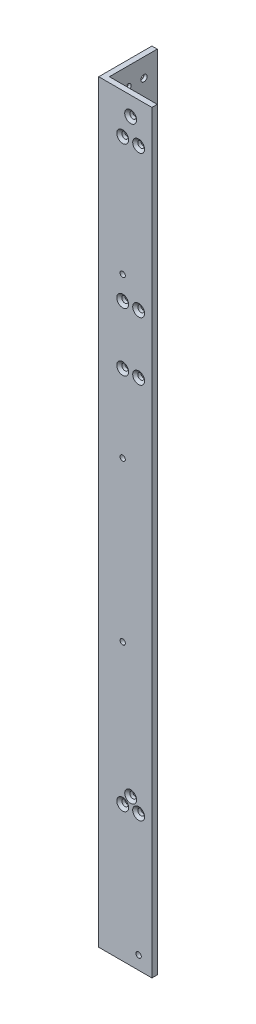
from build123d import *

# Parameters (mm, degrees)
BOSS_EXTRUDE1_DEPTH                               = 450
RIGHTSIDEHOLES_SKETCH3_R                          = 1.5875
RIGHTSIDEHOLES_CUT_EXTRUDE1_DEPTH                 = 3.175
FRONTSIDEHOLES_SKETCH4_R                          = 1.5875
FRONTSIDEHOLES_SKETCH4_R_2                        = 2
FRONTSIDEHOLES_CUT_EXTRUDE2_DEPTH                 = 3.175
CSK_FOR_6_FLAT_HEAD_MACHINE_SCREW_100_D           = 3.7973
CSK_FOR_6_FLAT_HEAD_MACHINE_SCREW_100_CSINK_D     = 7.0866
CSK_FOR_6_FLAT_HEAD_MACHINE_SCREW_100_CSINK_ANGLE = 100
CSK_FOR_6_FLAT_HEAD_MACHINE_SCREW_2_D             = 3.7973
CSK_FOR_6_FLAT_HEAD_MACHINE_SCREW_2_CSINK_D       = 7.0866
CSK_FOR_6_FLAT_HEAD_MACHINE_SCREW_2_CSINK_ANGLE   = 100


with BuildPart() as part:
    # Sketch2 → Boss-Extrude1 (new body)
    with BuildSketch(Plane(origin=(0, 0, 0), x_dir=(1, 0, 0), z_dir=(0, 1, 0))):
        Polygon((0, 31.75), (3.175, 31.75), (3.175, 3.175), (31.75, 3.175), (31.75, 0), (0, 0), align=None)
    extrude(amount=BOSS_EXTRUDE1_DEPTH)

    # RightSideHoles-Sketch3 → RightSideHoles-Cut-Extrude1 (cut)
    with BuildSketch(Plane.XY):
        with Locations((14.2875, 81.1125)):
            Circle(RIGHTSIDEHOLES_SKETCH3_R)
        with Locations((23.8125, 81.1125)):
            Circle(RIGHTSIDEHOLES_SKETCH3_R)
        with Locations((19.05, 87.4625)):
            Circle(RIGHTSIDEHOLES_SKETCH3_R)
        with Locations((14.2875, 426.1875)):
            Circle(RIGHTSIDEHOLES_SKETCH3_R)
        with Locations((19.05, 438.8875)):
            Circle(RIGHTSIDEHOLES_SKETCH3_R)
        with Locations((23.8125, 426.1875)):
            Circle(RIGHTSIDEHOLES_SKETCH3_R)
        with Locations((14.2875, 341.24737)):
            Circle(RIGHTSIDEHOLES_SKETCH3_R)
        with Locations((23.8125, 341.24737)):
            Circle(RIGHTSIDEHOLES_SKETCH3_R)
        with Locations((14.2875, 306.32237)):
            Circle(RIGHTSIDEHOLES_SKETCH3_R)
        with Locations((23.8125, 306.32237)):
            Circle(RIGHTSIDEHOLES_SKETCH3_R)
        with Locations((23.8125, 7.9375)):
            Circle(RIGHTSIDEHOLES_SKETCH3_R)
        with Locations((14.2875, 165)):
            Circle(RIGHTSIDEHOLES_SKETCH3_R)
        with Locations((14.2875, 260)):
            Circle(RIGHTSIDEHOLES_SKETCH3_R)
        with Locations((14.2875, 355)):
            Circle(RIGHTSIDEHOLES_SKETCH3_R)
    extrude(amount=-RIGHTSIDEHOLES_CUT_EXTRUDE1_DEPTH, mode=Mode.SUBTRACT)

    # FrontSideHoles-Sketch4 → FrontSideHoles-Cut-Extrude2 (cut)
    with BuildSketch(Plane.ZY):
        with Locations((-19.05, 81.1125)):
            Circle(FRONTSIDEHOLES_SKETCH4_R)
        with Locations((-23.8125, 87.4625)):
            Circle(FRONTSIDEHOLES_SKETCH4_R)
        with Locations((-14.2875, 87.4625)):
            Circle(FRONTSIDEHOLES_SKETCH4_R)
        with Locations((-23.8125, 438.8875)):
            Circle(FRONTSIDEHOLES_SKETCH4_R)
        with Locations((-14.2875, 438.8875)):
            Circle(FRONTSIDEHOLES_SKETCH4_R)
        with Locations((-19.05, 426.1875)):
            Circle(FRONTSIDEHOLES_SKETCH4_R)
        with Locations((-17.4625, 354.18487)):
            Circle(FRONTSIDEHOLES_SKETCH4_R_2)
        with Locations((-17.4625, 313.98487)):
            Circle(FRONTSIDEHOLES_SKETCH4_R_2)
        with Locations((-14.2875, 165)):
            Circle(FRONTSIDEHOLES_SKETCH4_R)
        with Locations((-14.2875, 260)):
            Circle(FRONTSIDEHOLES_SKETCH4_R)
        with Locations((-23.8125, 7.9375)):
            Circle(FRONTSIDEHOLES_SKETCH4_R)
    extrude(amount=-FRONTSIDEHOLES_CUT_EXTRUDE2_DEPTH, mode=Mode.SUBTRACT)

    # CSK for _6 Flat Head Machine Screw _100 (through all)
    with Locations(Plane.ZY):
        with Locations((-23.8125, 438.8875), (-19.05, 426.1875), (-14.2875, 438.8875), (-19.05, 81.1125), (-14.2875, 87.4625), (-23.8125, 87.4625)):
            CounterSinkHole(CSK_FOR_6_FLAT_HEAD_MACHINE_SCREW_100_D / 2, CSK_FOR_6_FLAT_HEAD_MACHINE_SCREW_100_CSINK_D / 2, counter_sink_angle=CSK_FOR_6_FLAT_HEAD_MACHINE_SCREW_100_CSINK_ANGLE)

    # CSK for _6 Flat Head Machine Screw _ 2 (through all)
    with Locations(Plane.XY):
        with Locations((14.2875, 81.1125), (19.05, 87.4625), (23.8125, 81.1125), (14.2875, 306.32237), (23.8125, 306.32237), (14.2875, 341.24737), (23.8125, 341.24737), (14.2875, 426.1875), (23.8125, 426.1875), (19.05, 438.8875)):
            CounterSinkHole(CSK_FOR_6_FLAT_HEAD_MACHINE_SCREW_2_D / 2, CSK_FOR_6_FLAT_HEAD_MACHINE_SCREW_2_CSINK_D / 2, counter_sink_angle=CSK_FOR_6_FLAT_HEAD_MACHINE_SCREW_2_CSINK_ANGLE)


solid = part.part
